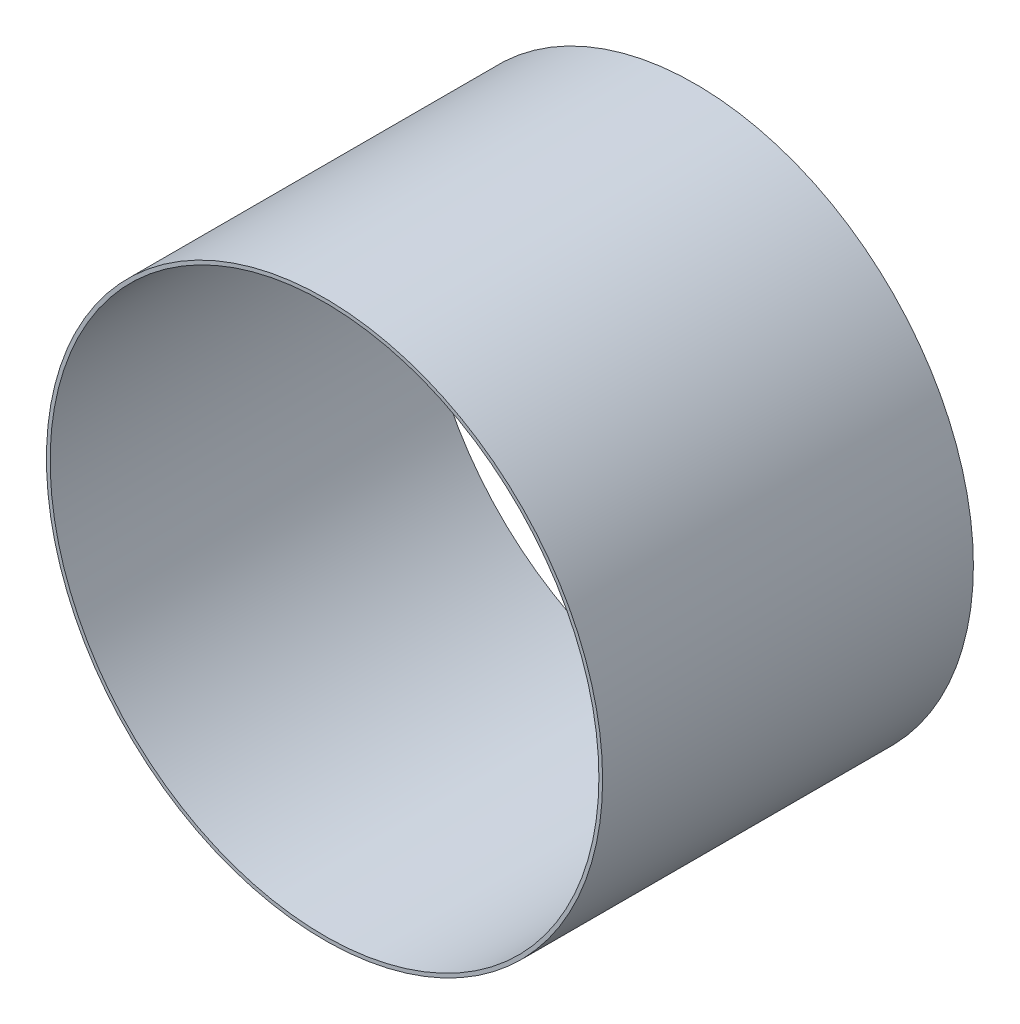
from build123d import *

# Parameters (mm, degrees)
SKETCH_1_R      = 75
EXTRUDE_1_DEPTH = 100
SHELL_1_T       = -1


with BuildPart() as part:
    # 草图1 → 凸台-拉伸1 (new body)
    with BuildSketch(Plane.XY):
        Circle(SKETCH_1_R)
    extrude(amount=EXTRUDE_1_DEPTH)

    # 抽壳1
    shell_1_openings = [part.faces().sort_by_distance(p)[0] for p in [
        (0, 0, 0),
        (0, 0, 100),
    ]]
    offset(amount=SHELL_1_T, openings=shell_1_openings, kind=Kind.INTERSECTION)


solid = part.part
